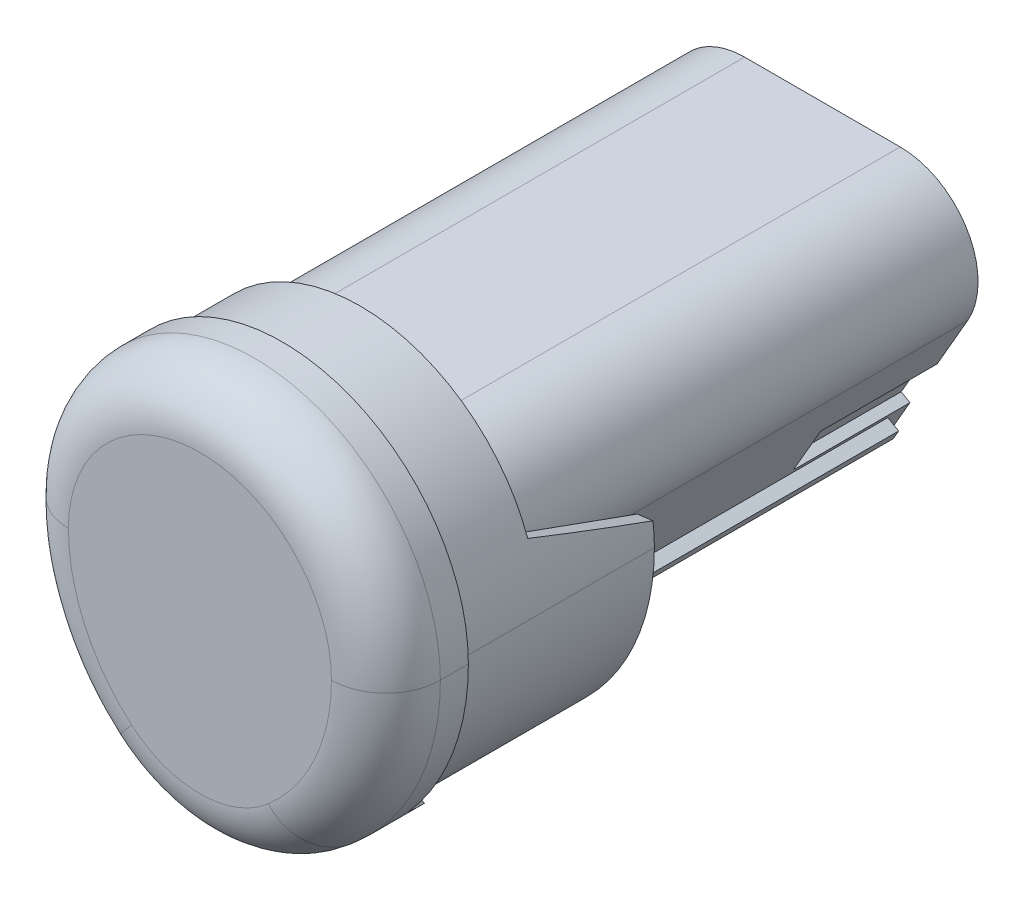
from build123d import *
from OCP.BRepFilletAPI import BRepFilletAPI_MakeChamfer

# Parameters (mm, degrees)
BOSS_EXTRU_1_DEPTH      = 80
BOSS_EXTRU_2_DEPTH      = 10.6
BOSS_EXTRU_3_DEPTH      = 10
BOSS_EXTRU_4_DEPTH      = 3.5
CHANFREIN1_SIZE         = 2
CHANFREIN1_SIZE_2       = 3.5
BOSS_EXTRU_5_DEPTH      = 14.9
CHANFREIN2_SIZE         = 5
CHANFREIN2_SIZE_2       = 14.9
ENL_V_MAT_EXTRU_1_DEPTH = 61.9
BOSS_EXTRU_8_REACH      = 92.636
BOSS_EXTRU_8_START      = -2.5
ENL_V_MAT_EXTRU_4_DEPTH = 15
CONG_1_R                = 7


with BuildPart() as part:
    # Esquisse1 → Boss.-Extru.1 (new body)
    with BuildSketch(Plane.XY):
        with BuildLine():
            Line((-9.999999999999973, 15.773502691896244), (9.999999999999973, 15.773502691896244))
            ThreePointArc((9.999999999999973, 15.773502691896244), (18.66025403784436, 10.773502691896228), (18.66025403784438, 0.7735026918962024))
            Line((18.66025403784438, 0.7735026918962024), (8.660254037844393, -16.54700538379251))
            ThreePointArc((8.660254037844393, -16.54700538379251), (-4.87e-15, -21.5470053837925), (-8.660254037844393, -16.54700538379251))
            Line((-8.660254037844393, -16.54700538379251), (-18.66025403784438, 0.7735026918962024))
            ThreePointArc((-18.66025403784438, 0.7735026918962024), (-18.66025403784441, 10.773502691896235), (-9.999999999999973, 15.773502691896244))
        make_face()
    extrude(amount=BOSS_EXTRU_1_DEPTH)

    # Esquisse2 → Boss.-Extru.2 (add)
    with BuildSketch(Plane.XY.offset(80)):
        with BuildLine():
            Line((0, 23.773502691896258), (0, -28.226497308103742))
            ThreePointArc((0, -28.226497308103742), (-7.138520611844601, -26.935621886911633), (-13.372879499304581, -23.22649730810374))
            ThreePointArc((-13.372879499304581, -23.22649730810374), (-21.14415675858487, -12.819312855059437), (-23.89999999999999, -0.12649730810374363))
            ThreePointArc((-23.89999999999999, -0.12649730810374363), (-16.89985207035848, 16.773354762254744), (0, 23.773502691896258))
        make_face()
    boss_extru_2 = extrude(amount=-BOSS_EXTRU_2_DEPTH)

    # Symétrie1: Boss.-Extru.2 across plane
    add(boss_extru_2.mirror(Plane(origin=(0, 0, 0), x_dir=(0, 0, 1), z_dir=(1, 0, 0))))

    # Esquisse4 → Boss.-Extru.3 (add)
    with BuildSketch(Plane(origin=(0, 0, 69.4), x_dir=(-1, 0, 0), z_dir=(0, 0, -1))):
        with BuildLine():
            ThreePointArc((-12.716812029717252, -22.471795065262707), (-2.04e-15, -27.226497308103735), (12.71681202971725, -22.4717950652627))
            ThreePointArc((12.71681202971725, -22.4717950652627), (20.2341931687673, -12.404624700892555), (22.899999999999995, -0.12649730810373652))
            ThreePointArc((22.899999999999995, -0.12649730810373652), (-6.91e-15, 22.773502691896258), (-22.899999999999995, -0.12649730810373735))
            ThreePointArc((-22.899999999999995, -0.12649730810373735), (-20.234193168767305, -12.404624700892553), (-12.716812029717252, -22.471795065262707))
        make_face()
    extrude(amount=BOSS_EXTRU_3_DEPTH)

    # Esquisse6 → Boss.-Extru.4 (add)
    with BuildSketch(Plane(origin=(0, 0, 69.4), x_dir=(-1, 0, 0), z_dir=(0, 0, -1))):
        with BuildLine():
            Line((14.75, -21.95321690393977), (0, -13.476497308103742))
            Line((0, -13.476497308103742), (0, -28.226497308103742))
            ThreePointArc((0, -28.226497308103742), (7.138520611844594, -26.935621886911633), (13.372879499304576, -23.226497308103735))
            ThreePointArc((13.372879499304576, -23.226497308103735), (14.071194795630928, -22.600407707254973), (14.75, -21.95321690393977))
        make_face()
    boss_extru_4 = extrude(amount=BOSS_EXTRU_4_DEPTH)

    # Symétrie2: Boss.-Extru.4 across plane
    add(boss_extru_4.mirror(Plane(origin=(0, 0, 0), x_dir=(0, 0, 1), z_dir=(1, 0, 0))))

    # Chanfrein1
    chanfrein1_edges_1 = [part.edges().sort_by_distance(p)[0] for p in [
        (-14.299309891443901, -21.69420851920438, 69.4),
    ]]
    chanfrein1_side_1 = [part.faces().sort_by_distance(p)[0] for p in [
        (-14.319240730556658, -21.659527664943543, 69.4),
    ]]
    chanfrein1_edges_2 = [part.edges().sort_by_distance(p)[0] for p in [
        (14.299309891443906, -21.694208519204384, 69.4),
    ]]
    chanfrein1_side_2 = [part.faces().sort_by_distance(p)[0] for p in [
        (14.319240730556663, -21.659527664943546, 69.4),
    ]]
    chanfrein1 = BRepFilletAPI_MakeChamfer(part.part.solid().wrapped)
    for e in chanfrein1_edges_1:
        chanfrein1.Add(CHANFREIN1_SIZE - 0.0001, CHANFREIN1_SIZE_2 - 0.0001, e.wrapped, chanfrein1_side_1[0].wrapped)
    for e in chanfrein1_edges_2:
        chanfrein1.Add(CHANFREIN1_SIZE - 0.0001, CHANFREIN1_SIZE_2 - 0.0001, e.wrapped, chanfrein1_side_2[0].wrapped)
    add(Compound.cast(chanfrein1.Shape()), mode=Mode.REPLACE)  # a hair under: the kernel refuses the full size

    # Esquisse7 → Boss.-Extru.5 (add)
    with BuildSketch(Plane(origin=(0, 0, 59.4), x_dir=(-1, 0, 0), z_dir=(0, 0, -1))):
        with BuildLine():
            Line((-6.79e-15, -27.22649730810374), (0, 0))
            Line((0, 0), (22.71563338320109, 2.7735026918962267))
            ThreePointArc((22.71563338320109, 2.7735026918962267), (22.853861867037974, 1.3264299999015228), (22.899999999999995, -0.12649730810374016))
            ThreePointArc((22.899999999999995, -0.12649730810374016), (20.2341931687673, -12.404624700892562), (12.716812029717245, -22.471795065262707))
            ThreePointArc((12.716812029717245, -22.471795065262707), (6.788307992740876, -25.998951656029643), (-6.79e-15, -27.22649730810374))
        make_face()
    boss_extru_5 = extrude(amount=BOSS_EXTRU_5_DEPTH)

    # Symétrie4: Boss.-Extru.5 across plane
    add(boss_extru_5.mirror(Plane(origin=(0, 0, 0), x_dir=(0, 0, 1), z_dir=(1, 0, 0))))

    # Chanfrein2
    chanfrein2_edges_1 = [part.edges().sort_by_distance(p)[0] for p in [
        (21.059128460282075, 2.5712489935136453, 59.4),
    ]]
    chanfrein2_side_1 = [part.faces().sort_by_distance(p)[0] for p in [
        (21.04700879877706, 2.6705118456034573, 59.4),
    ]]
    chanfrein2_edges_2 = [part.edges().sort_by_distance(p)[0] for p in [
        (-21.059128460282082, 2.571248993513646, 59.4),
    ]]
    chanfrein2_side_2 = [part.faces().sort_by_distance(p)[0] for p in [
        (-21.059128460282082, 2.571248993513646, 59.3),
    ]]
    chanfrein2 = BRepFilletAPI_MakeChamfer(part.part.solid().wrapped)
    for e in chanfrein2_edges_1:
        chanfrein2.Add(CHANFREIN2_SIZE - 0.0001, CHANFREIN2_SIZE_2 - 0.0001, e.wrapped, chanfrein2_side_1[0].wrapped)
    for e in chanfrein2_edges_2:
        chanfrein2.Add(CHANFREIN2_SIZE_2 - 0.0001, CHANFREIN2_SIZE - 0.0001, e.wrapped, chanfrein2_side_2[0].wrapped)
    add(Compound.cast(chanfrein2.Shape()), mode=Mode.REPLACE)  # a hair under: the kernel refuses the full size

    # Esquisse8 → Enlèv. mat.-Extru.1 (cut)
    with BuildSketch(Plane(origin=(0, 0, 0), x_dir=(-1, 0, 0), z_dir=(0, 0, -1))):
        with BuildLine():
            Line((-20.73173527113113, 2.5202275827259273), (-20.108299540895768, 7.138156637600371))
            ThreePointArc((-20.108299540895768, 7.138156637600371), (-18.785258977060302, 10.95609130242486), (-16.08354229758742, 13.96071913666333))
            Line((-16.08354229758742, 13.96071913666333), (-12.465297452899778, 16.64926972087978))
            ThreePointArc((-12.465297452899778, 16.64926972087978), (8.34e-15, 20.773502691896244), (12.465297452899788, 16.649269720879765))
            Line((12.465297452899788, 16.649269720879765), (16.083542297587456, 13.96071913666329))
            ThreePointArc((16.083542297587456, 13.96071913666329), (18.78525897706036, 10.956091302424788), (20.108299540895814, 7.13815663760026))
            Line((20.108299540895814, 7.13815663760026), (20.73173527113112, 2.5202275827259264))
            ThreePointArc((20.73173527113112, 2.5202275827259264), (20.857891398301028, 1.1995367852285772), (20.89999999999999, -0.12649730810373677))
            ThreePointArc((20.89999999999999, -0.12649730810373677), (18.414265989132176, -11.5752483925588), (11.404677090542576, -20.962390579580656))
            ThreePointArc((11.404677090542576, -20.962390579580656), (1.69e-15, -25.226497308103735), (-11.40467709054258, -20.962390579580664))
            ThreePointArc((-11.40467709054258, -20.962390579580664), (-18.414265989132176, -11.575248392558798), (-20.89999999999999, -0.1264973081037376))
            ThreePointArc((-20.89999999999999, -0.1264973081037376), (-20.85789139830103, 1.1995367852285768), (-20.73173527113113, 2.5202275827259273))
        make_face()
        with BuildLine():
            Line((-18.66025403784436, 0.773502691896218), (-8.660254037844393, -16.54700538379251))
            ThreePointArc((-8.660254037844393, -16.54700538379251), (6.09e-15, -21.547005383792524), (8.660254037844393, -16.54700538379251))
            Line((8.660254037844393, -16.54700538379251), (18.66025403784438, 0.7735026918962024))
            ThreePointArc((18.66025403784438, 0.7735026918962024), (18.66025403784438, 10.773502691896217), (9.999999999999973, 15.773502691896226))
            Line((9.999999999999973, 15.773502691896226), (-9.999999999999973, 15.773502691896244))
            ThreePointArc((-9.999999999999973, 15.773502691896244), (-18.660254037844357, 10.77350269189623), (-18.66025403784436, 0.773502691896218))
        make_face(mode=Mode.SUBTRACT)
    extrude(amount=-ENL_V_MAT_EXTRU_1_DEPTH, mode=Mode.SUBTRACT)

    # Esquisse9 → Boss.-Extru.8 (add, up to next)
    with BuildSketch(Plane(origin=(0, 0, 0), x_dir=(-1, 0, 0), z_dir=(0, 0, -1)).offset(BOSS_EXTRU_8_START), mode=Mode.PRIVATE) as boss_extru_8_sk1:
        Polygon((-10.214359353944898, -13.855216015993522), (-11.599999999999998, -14.655216015993522), (-12.3, -13.442780450695311), (-10.914359353944906, -12.642780450695314), align=None)
    boss_extru_8_tool1 = extrude(boss_extru_8_sk1.sketch, amount=-BOSS_EXTRU_8_REACH, mode=Mode.PRIVATE) - part.part
    # Esquisse9 → Boss.-Extru.8 (add, up to next)
    with BuildSketch(Plane(origin=(0, 0, 0), x_dir=(-1, 0, 0), z_dir=(0, 0, -1)).offset(BOSS_EXTRU_8_START), mode=Mode.PRIVATE) as boss_extru_8_sk2:
        Polygon((10.914359353944906, -12.642780450695314), (10.214359353944898, -13.855216015993522), (11.599999999999998, -14.655216015993522), (12.3, -13.442780450695311), align=None)
    boss_extru_8_tool2 = extrude(boss_extru_8_sk2.sketch, amount=-BOSS_EXTRU_8_REACH, mode=Mode.PRIVATE) - part.part
    add(boss_extru_8_tool1.solids().sort_by_distance((11.25718, -13.648998, 2.5))[0])
    add(boss_extru_8_tool2.solids().sort_by_distance((-11.25718, -13.648998, 2.5))[0])

    # Esquisse10 → Enlèv. mat.-Extru.4 (cut)
    with BuildSketch(Plane(origin=(0, 0, 0), x_dir=(-1, 0, 0), z_dir=(0, 0, -1))):
        Polygon((-11.249999999999988, -12.061433798642668), (-10.124166975080218, -11.411433798642664), (-13.624166975080218, -5.349255972151593), (-14.74999999999999, -5.999255972151601), align=None)
        Polygon((11.250000000000012, -12.061433798642668), (14.750000000000009, -5.9992559721515955), (13.624166975080241, -5.349255972151597), (10.124166975080241, -11.411433798642667), align=None)
    extrude(amount=-ENL_V_MAT_EXTRU_4_DEPTH, mode=Mode.SUBTRACT)

    # Congé1
    cong_1_edges = [part.edges().sort_by_distance(p)[0] for p in [
        (-1.79e-15, 23.773502691896258, 80),
        (-21.144156758584863, -12.819312855059447, 80),
        (6.22e-15, -28.226497308103745, 80),
        (21.144156758584863, -12.819312855059447, 80),
    ]]
    fillet(cong_1_edges, radius=CONG_1_R)


solid = part.part
